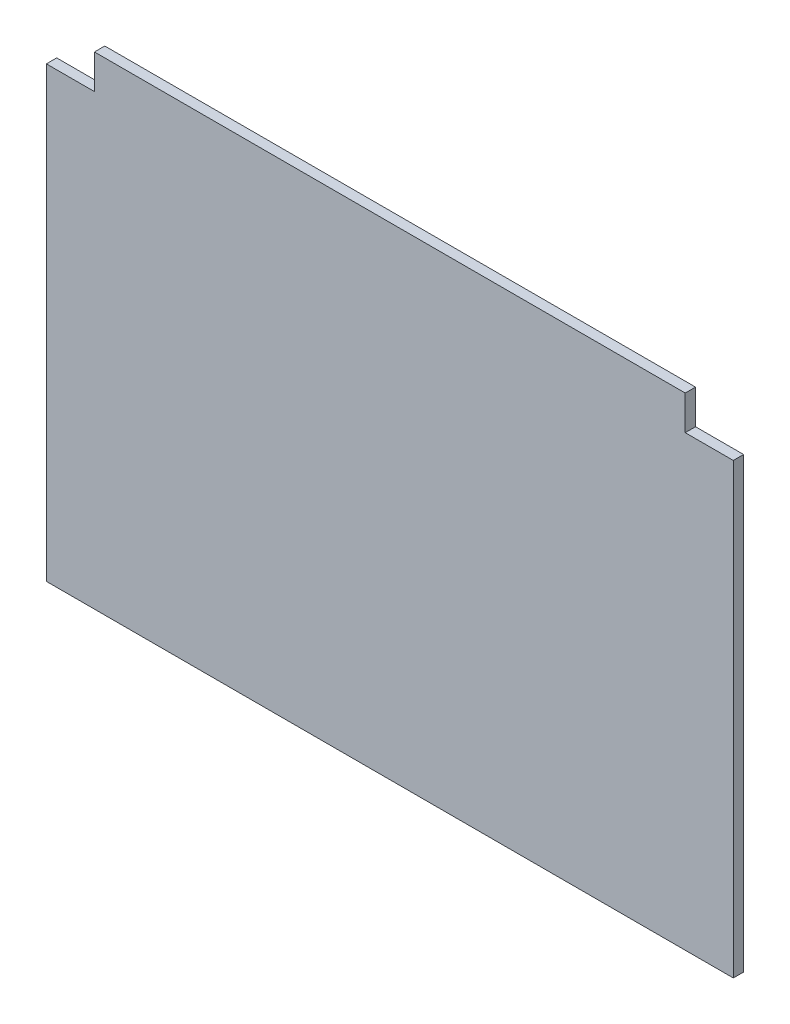
from build123d import *

# Parameters (mm, degrees)
SKETCH1_W           = 400
SKETCH1_H           = 281
BOSS_EXTRUDE1_DEPTH = 6
SKETCH2_W           = 28
SKETCH2_H           = 20
CUT_EXTRUDE1_DEPTH  = 10


with BuildPart() as part:
    # Sketch1 → Boss-Extrude1 (new body)
    with BuildSketch(Plane.XY):
        with Locations((171.428571429, 117.604761905)):
            Rectangle(SKETCH1_W, SKETCH1_H)
    extrude(amount=BOSS_EXTRUDE1_DEPTH)

    # Sketch2 → Cut-Extrude1 (cut)
    with BuildSketch(Plane.XY.offset(6)):
        with Locations((-14.571428571, 248.104761905)):
            Rectangle(SKETCH2_W, SKETCH2_H)
        with Locations((357.428571429, 248.104761905)):
            Rectangle(SKETCH2_W, SKETCH2_H)
    extrude(amount=-CUT_EXTRUDE1_DEPTH, mode=Mode.SUBTRACT)


solid = part.part
